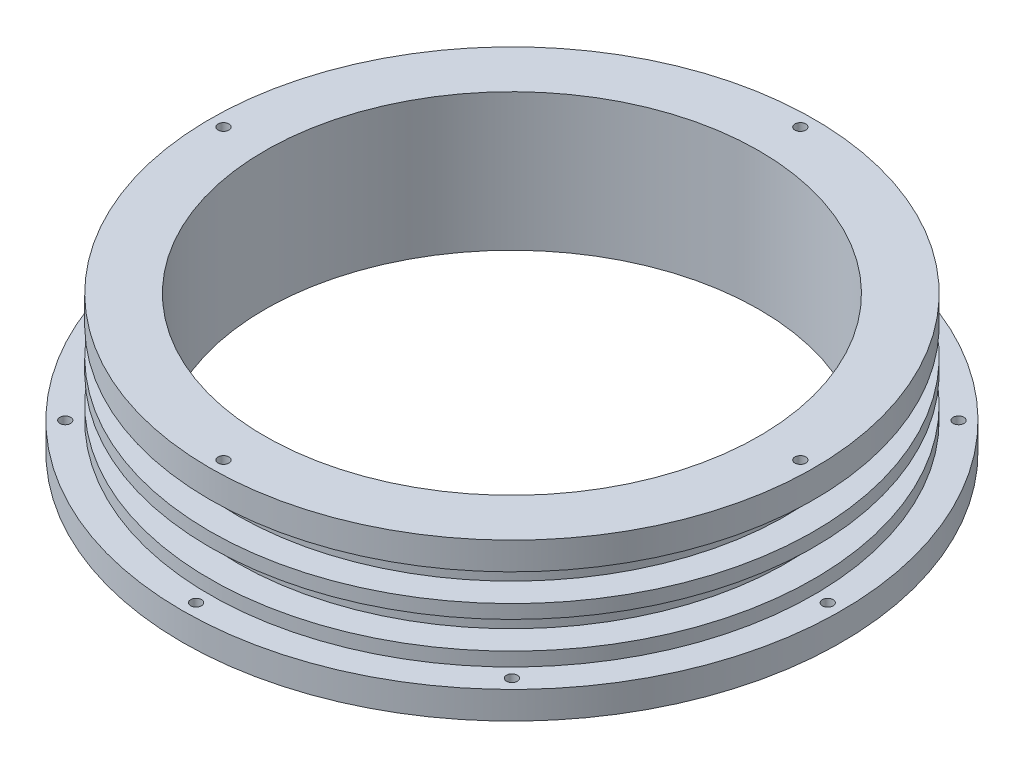
from build123d import *

# Parameters (mm, degrees)
SKETCH2_R           = 76.2
BOSS_EXTRUDE1_DEPTH = 6.35
SKETCH3_R           = 69.85
BOSS_EXTRUDE2_DEPTH = 9.525
SKETCH4_R           = 63.5
BOSS_EXTRUDE3_DEPTH = 15.875
SKETCH6_R           = 69.85
BOSS_EXTRUDE4_DEPTH = 3.175
SKETCH7_R           = 63.5
BOSS_EXTRUDE5_DEPTH = 6.35
SKETCH8_R           = 69.85
BOSS_EXTRUDE6_DEPTH = 6.35
SKETCH9_R           = 57.15
CUT_EXTRUDE1_DEPTH  = 113.342968182
SKETCH10_R          = 1.24968
CUT_EXTRUDE2_DEPTH  = 111.716033166
SKETCH11_R          = 69.85
SKETCH11_R_2        = 63.5
CUT_EXTRUDE3_DEPTH  = 3.175
SKETCH12_R          = 1.24968
CUT_EXTRUDE4_DEPTH  = 3.175


with BuildPart() as part:
    # Sketch2 → Boss-Extrude1 (new body)
    with BuildSketch(Plane(origin=(0, 0, 0), x_dir=(1, 0, 0), z_dir=(0, 1, 0))):
        Circle(SKETCH2_R)
    extrude(amount=BOSS_EXTRUDE1_DEPTH)

    # Sketch3 → Boss-Extrude2 (add)
    with BuildSketch(Plane(origin=(0, 0, 0), x_dir=(1, 0, 0), z_dir=(0, 1, 0))):
        Circle(SKETCH3_R)
    extrude(amount=BOSS_EXTRUDE2_DEPTH)

    # Sketch4 → Boss-Extrude3 (add)
    with BuildSketch(Plane(origin=(0, 0, 0), x_dir=(1, 0, 0), z_dir=(0, 1, 0))):
        Circle(SKETCH4_R)
    extrude(amount=BOSS_EXTRUDE3_DEPTH)

    # Sketch6 → Boss-Extrude4 (add)
    with BuildSketch(Plane(origin=(0, 15.875, 0), x_dir=(1, 0, 0), z_dir=(0, 1, 0))):
        Circle(SKETCH6_R)
    extrude(amount=BOSS_EXTRUDE4_DEPTH)

    # Sketch7 → Boss-Extrude5 (add)
    with BuildSketch(Plane(origin=(0, 19.05, 0), x_dir=(1, 0, 0), z_dir=(0, 1, 0))):
        Circle(SKETCH7_R)
    extrude(amount=BOSS_EXTRUDE5_DEPTH)

    # Sketch8 → Boss-Extrude6 (add)
    with BuildSketch(Plane(origin=(0, 25.4, 0), x_dir=(1, 0, 0), z_dir=(0, 1, 0))):
        Circle(SKETCH8_R)
    extrude(amount=BOSS_EXTRUDE6_DEPTH)

    # Sketch9 → Cut-Extrude1 (cut, through all)
    with BuildSketch(Plane.XZ):
        Circle(SKETCH9_R)
    extrude(amount=-CUT_EXTRUDE1_DEPTH, mode=Mode.SUBTRACT)

    # Sketch10 → Cut-Extrude2 (cut, through all)
    with BuildSketch(Plane(origin=(0, 6.35, 0), x_dir=(1, 0, 0), z_dir=(0, 1, 0))):
        with Locations((0, 73.025)):
            Circle(SKETCH10_R)
        with Locations((51.636472696, 51.636472696)):
            Circle(SKETCH10_R)
        with Locations((73.025, 0)):
            Circle(SKETCH10_R)
        with Locations((51.636472696, -51.636472696)):
            Circle(SKETCH10_R)
        with Locations((0, -73.025)):
            Circle(SKETCH10_R)
        with Locations((-51.636472696, -51.636472696)):
            Circle(SKETCH10_R)
        with Locations((-73.025, 0)):
            Circle(SKETCH10_R)
        with Locations((-51.636472696, 51.636472696)):
            Circle(SKETCH10_R)
    extrude(amount=-CUT_EXTRUDE2_DEPTH, mode=Mode.SUBTRACT)

    # Sketch11 → Cut-Extrude3 (cut)
    with BuildSketch(Plane.XZ):
        Circle(SKETCH11_R)
        Circle(SKETCH11_R_2, mode=Mode.SUBTRACT)
    extrude(amount=-CUT_EXTRUDE3_DEPTH, mode=Mode.SUBTRACT)

    # Sketch12 → Cut-Extrude4 (cut)
    with BuildSketch(Plane(origin=(0, 31.75, 0), x_dir=(1, 0, 0), z_dir=(0, 1, 0))):
        with Locations((0, -66.675)):
            Circle(SKETCH12_R)
        with Locations((-66.675, 0)):
            Circle(SKETCH12_R)
        with Locations((0, 66.675)):
            Circle(SKETCH12_R)
        with Locations((66.675, 0)):
            Circle(SKETCH12_R)
    extrude(amount=-CUT_EXTRUDE4_DEPTH, mode=Mode.SUBTRACT)


solid = part.part
